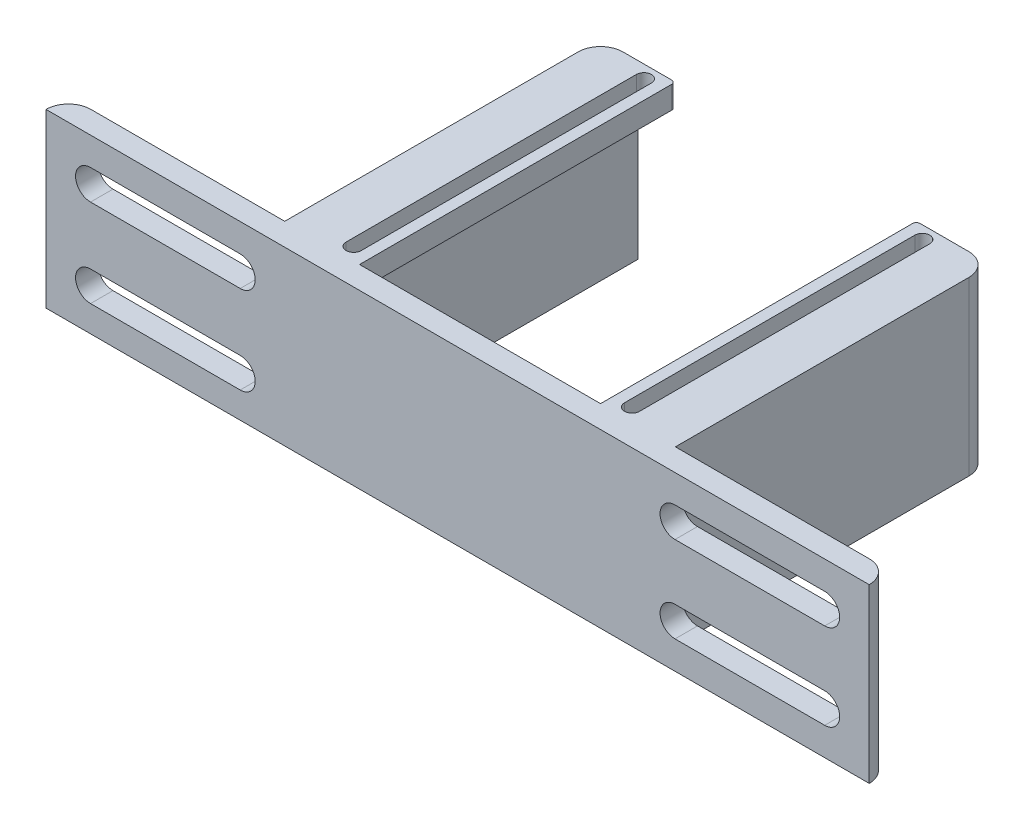
from build123d import *

# Parameters (mm, degrees)
BOSS_EXTRUDE5_DEPTH = 23
SKETCH3_W           = 5
SKETCH3_H           = 3
BOSS_EXTRUDE7_DEPTH = 42.2
CUT_EXTRUDE3_DEPTH  = 42.2
CUT_EXTRUDE4_DEPTH  = 42.2
FILLET1_R           = 3
FILLET2_R           = 3
FILLET3_R           = 0.5
FILLET4_R           = 0.5
FILLET5_R           = 3
FILLET6_R           = 3
CUT_EXTRUDE5_DEPTH  = 42.2
CUT_EXTRUDE6_DEPTH  = 42.2
CUT_EXTRUDE7_DEPTH  = 42.2


with BuildPart() as part:
    # Sketch1 → Boss-Extrude5 (new body)
    with BuildSketch(Plane(origin=(0, 0, 0), x_dir=(1, 0, 0), z_dir=(0, 1, 0))):
        Polygon((-55, 0), (55, 0), (55, 3), (26.1, 3), (26.1, 45.2), (21.1, 45.2), (21.1, 3), (-21.1, 3), (-21.1, 45.2), (-26.1, 45.2), (-26.1, 3), (-55, 3), align=None)
    extrude(amount=BOSS_EXTRUDE5_DEPTH)

    # Sketch3 → Boss-Extrude7 (add)
    with BuildSketch(Plane(origin=(0, 0, -3), x_dir=(-1, 0, 0), z_dir=(0, 0, -1))):
        with Locations((-18.6, 21.5)):
            Rectangle(SKETCH3_W, SKETCH3_H)
        with Locations((18.6, 21.5)):
            Rectangle(SKETCH3_W, SKETCH3_H)
    extrude(amount=BOSS_EXTRUDE7_DEPTH)

    # Sketch5 → Cut-Extrude3 (cut)
    with BuildSketch(Plane(origin=(0, 20, 0), x_dir=(-1, 0, 0), z_dir=(0, -1, 0))):
        with BuildLine():
            Line((-17.6, 43.490720045), (-17.6, 4.709279955))
            ThreePointArc((-17.6, 4.709279955), (-18.6, 3.709279955), (-19.6, 4.709279955))
            Line((-19.6, 4.709279955), (-19.6, 43.490720045))
            ThreePointArc((-19.6, 43.490720045), (-18.6, 44.490720045), (-17.6, 43.490720045))
        make_face()
    extrude(amount=-CUT_EXTRUDE3_DEPTH, mode=Mode.SUBTRACT)

    # Sketch5<4> → Cut-Extrude4 (cut)
    with BuildSketch(Plane(origin=(0, 20, 0), x_dir=(-1, 0, 0), z_dir=(0, -1, 0))):
        with BuildLine():
            Line((17.6, 4.709279955), (17.6, 43.490720045))
            ThreePointArc((17.6, 43.490720045), (18.6, 44.490720045), (19.6, 43.490720045))
            Line((19.6, 43.490720045), (19.6, 4.709279955))
            ThreePointArc((19.6, 4.709279955), (18.6, 3.709279955), (17.6, 4.709279955))
        make_face()
    extrude(amount=-CUT_EXTRUDE4_DEPTH, mode=Mode.SUBTRACT)

    # Fillet1
    fillet1_edges = [part.edges().sort_by_distance(p)[0] for p in [
        (-26.1, 11.5, -45.2),
    ]]
    fillet(fillet1_edges, radius=FILLET1_R)

    # Fillet2
    fillet2_edges = [part.edges().sort_by_distance(p)[0] for p in [
        (26.1, 11.5, -45.2),
    ]]
    fillet(fillet2_edges, radius=FILLET2_R)

    # Fillet3
    fillet3_edges = [part.edges().sort_by_distance(p)[0] for p in [
        (-16.1, 21.5, -45.2),
    ]]
    fillet(fillet3_edges, radius=FILLET3_R)

    # Fillet4
    fillet4_edges = [part.edges().sort_by_distance(p)[0] for p in [
        (16.1, 21.5, -45.2),
    ]]
    fillet(fillet4_edges, radius=FILLET4_R)

    # Fillet5
    fillet5_edges = [part.edges().sort_by_distance(p)[0] for p in [
        (55, 11.5, -3),
    ]]
    fillet(fillet5_edges, radius=FILLET5_R - 0.0001)  # a hair under: the kernel refuses the full size

    # Fillet6
    fillet6_edges = [part.edges().sort_by_distance(p)[0] for p in [
        (-55, 11.5, -3),
    ]]
    fillet(fillet6_edges, radius=FILLET6_R - 0.0001)  # a hair under: the kernel refuses the full size

    # Sketch6 → Cut-Extrude5 (cut)
    with BuildSketch(Plane(origin=(0, 0, -3), x_dir=(-1, 0, 0), z_dir=(0, 0, -1))):
        with BuildLine():
            Line((-29.05, 15.25), (-49.05, 15.25))
            ThreePointArc((-49.05, 15.25), (-51.05, 17.25), (-49.05, 19.25))
            Line((-49.05, 19.25), (-29.05, 19.25))
            ThreePointArc((-29.05, 19.25), (-27.05, 17.25), (-29.05, 15.25))
        make_face()
        with BuildLine():
            Line((-29.05, 3.75), (-49.05, 3.75))
            ThreePointArc((-49.05, 3.75), (-51.05, 5.75), (-49.05, 7.75))
            Line((-49.05, 7.75), (-29.05, 7.75))
            ThreePointArc((-29.05, 7.75), (-27.05, 5.75), (-29.05, 3.75))
        make_face()
    extrude(amount=-CUT_EXTRUDE5_DEPTH, mode=Mode.SUBTRACT)

    # Sketch7 → Cut-Extrude6 (cut)
    with BuildSketch(Plane(origin=(0, 0, -3), x_dir=(-1, 0, 0), z_dir=(0, 0, -1))):
        with BuildLine():
            Line((49.05, 15.25), (29.05, 15.25))
            ThreePointArc((29.05, 15.25), (27.05, 17.25), (29.05, 19.25))
            Line((29.05, 19.25), (49.05, 19.25))
            ThreePointArc((49.05, 19.25), (51.05, 17.25), (49.05, 15.25))
        make_face()
    extrude(amount=-CUT_EXTRUDE6_DEPTH, mode=Mode.SUBTRACT)

    # Sketch7<3> → Cut-Extrude7 (cut)
    with BuildSketch(Plane(origin=(0, 0, -3), x_dir=(-1, 0, 0), z_dir=(0, 0, -1))):
        with BuildLine():
            Line((29.05, 7.503040911), (49.05, 7.503040911))
            ThreePointArc((49.05, 7.503040911), (51.05, 5.503040911), (49.05, 3.503040911))
            Line((49.05, 3.503040911), (29.05, 3.503040911))
            ThreePointArc((29.05, 3.503040911), (27.05, 5.503040911), (29.05, 7.503040911))
        make_face()
    extrude(amount=-CUT_EXTRUDE7_DEPTH, mode=Mode.SUBTRACT)


solid = part.part
